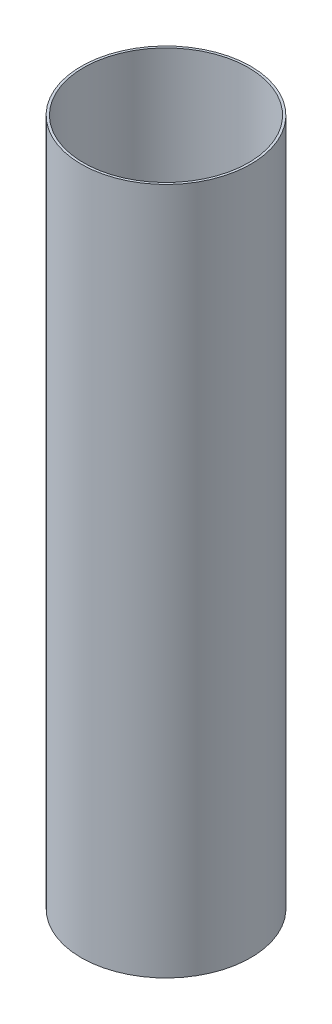
from build123d import *

# Parameters (mm, degrees)
SKETCH2_R           = 78.359
SKETCH2_R_2         = 76.2
BOSS_EXTRUDE1_DEPTH = 635


with BuildPart() as part:
    # Sketch2 → Boss-Extrude1 (new body)
    with BuildSketch(Plane(origin=(0, 0, 0), x_dir=(1, 0, 0), z_dir=(0, 1, 0))):
        Circle(SKETCH2_R)
        Circle(SKETCH2_R_2, mode=Mode.SUBTRACT)
    extrude(amount=BOSS_EXTRUDE1_DEPTH)


solid = part.part
